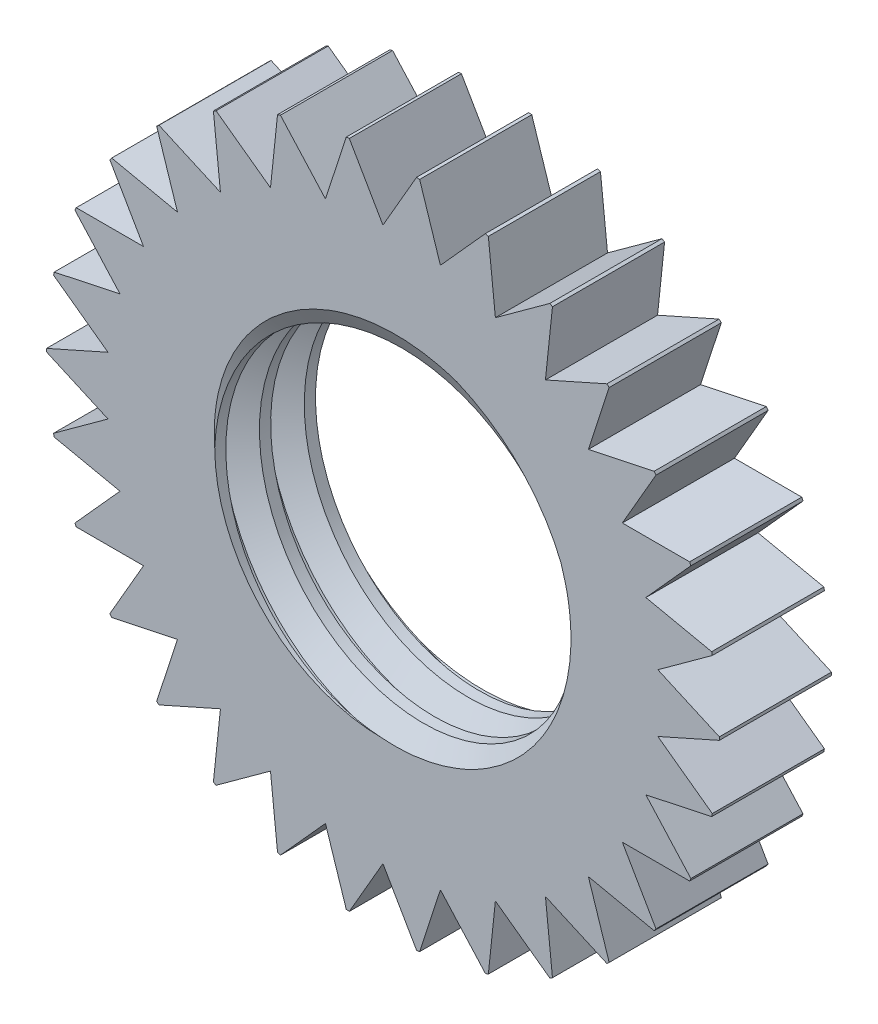
from build123d import *

# Parameters (mm, degrees)
SKETCH1_R           = 15
SKETCH1_R_2         = 7.5
BOSS_EXTRUDE1_DEPTH = 5
THREAD1_PITCH       = 2
CUT_EXTRUDE1_START  = -5
CUT_EXTRUDE1_DEPTH  = 27.794494878
CIRPATTERN1_COUNT   = 30


with BuildPart() as part:
    # Sketch1 → Boss-Extrude1 (new body)
    with BuildSketch(Plane.XY):
        Circle(SKETCH1_R)
        Circle(SKETCH1_R_2, mode=Mode.SUBTRACT)
    extrude(amount=BOSS_EXTRUDE1_DEPTH)

    # Thread1: the profile of Thread Profile1 profile screwed along a right-hand helix of 3.5 turns, 10 arcs to a turn; built about Z, then put on its axis
    thread1_z = Axis((0, 0, 0), (0, 0, 1))
    thread1_corners = [(7.4997, 0, -0.000173205), (8.58253175, 0, 0.624999997), (8.58253175, 0, 0.874999997), (7.4997, 0, 1.5001732)]
    with BuildLine(mode=Mode.PRIVATE) as thread1_profile:
        Line(thread1_corners[0], thread1_corners[1])
        Line(thread1_corners[1], thread1_corners[2])
        Line(thread1_corners[2], thread1_corners[3])
        Line(thread1_corners[3], thread1_corners[0])
    thread1_cap = Face(thread1_profile.wire())
    thread1_turn_angles = [0, 18, 36, 54, 72, 90, 108, 126, 144, 162, 180, 198, 216, 234, 252, 270, 288, 306, 324, 342, 360]
    thread1_turn_weights = [1, 0.9510565162951535, 1, 0.9510565162951535, 1, 0.9510565162951535, 1, 0.9510565162951535, 1, 0.9510565162951535, 1, 0.9510565162951535, 1, 0.9510565162951535, 1, 0.9510565162951535, 1, 0.9510565162951535, 1, 0.9510565162951535, 1]
    thread1_turn_rails = [Edge.make_bspline([Vector(p[0], p[1], 0).rotate(thread1_z, thread1_turn_angles[k]) / thread1_turn_weights[k] + Vector(0, 0, p[2] + THREAD1_PITCH * thread1_turn_angles[k] / 360) for k in range(21)], [0, 0, 0, 1, 1, 2, 2, 3, 3, 4, 4, 5, 5, 6, 6, 7, 7, 8, 8, 9, 9, 10, 10, 10], 2, thread1_turn_weights) for p in thread1_corners]
    thread1_turn_sides = [Face.make_surface_from_curves(thread1_turn_rails[p[0]], thread1_turn_rails[p[1]]) for p in [(0, 1), (1, 2), (2, 3), (3, 0)]]
    thread1_last_angles = [1080, 1098, 1116, 1134, 1152, 1170, 1188, 1206, 1224, 1242, 1260]
    thread1_last_weights = [1, 0.9510565162951535, 1, 0.9510565162951535, 1, 0.9510565162951535, 1, 0.9510565162951535, 1, 0.9510565162951535, 1]
    thread1_last_rails = [Edge.make_bspline([Vector(p[0], p[1], 0).rotate(thread1_z, thread1_last_angles[k]) / thread1_last_weights[k] + Vector(0, 0, p[2] + THREAD1_PITCH * thread1_last_angles[k] / 360) for k in range(11)], [0, 0, 0, 1, 1, 2, 2, 3, 3, 4, 4, 5, 5, 5], 2, thread1_last_weights) for p in thread1_corners]
    thread1_last_sides = [Face.make_surface_from_curves(thread1_last_rails[p[0]], thread1_last_rails[p[1]]) for p in [(0, 1), (1, 2), (2, 3), (3, 0)]]
    thread1 = Plane(origin=(0, 0, -2), x_dir=(1, 0, 0), z_dir=(0, 0, 1)) * Solid(Shell([*[p.moved(Location((0, 0, THREAD1_PITCH * i))) for i in range(3) for p in thread1_turn_sides], *thread1_last_sides, thread1_cap, thread1_cap.rotate(thread1_z, 1260).moved(Location((0, 0, THREAD1_PITCH * 1260 / 360)))]))
    add(thread1, mode=Mode.SUBTRACT)

    # Sketch5 → Cut-Extrude1 (cut)
    with BuildSketch(Plane.XY.offset(5).offset(CUT_EXTRUDE1_START)):
        Polygon((-95.87225496, 6.163367673), (-13.675265955, 6.163367673), (-10.675265955, 6.163367673), (-12.175265955, 8.761443884), (-53.273760457, 79.946124477), (-195.643121643, 162.143113482), (-238.241616146, 88.360356678), align=None)
    cut_extrude1 = extrude(amount=CUT_EXTRUDE1_DEPTH, mode=Mode.SUBTRACT)

    # CirPattern1: Cut-Extrude1 ×30 about axis
    cirpattern1_axis = Axis((0, 0, 5), (0, 0, 1))
    for i in range(1, CIRPATTERN1_COUNT):
        add(cut_extrude1.rotate(cirpattern1_axis, i * 360 / CIRPATTERN1_COUNT), mode=Mode.SUBTRACT)


solid = part.part
